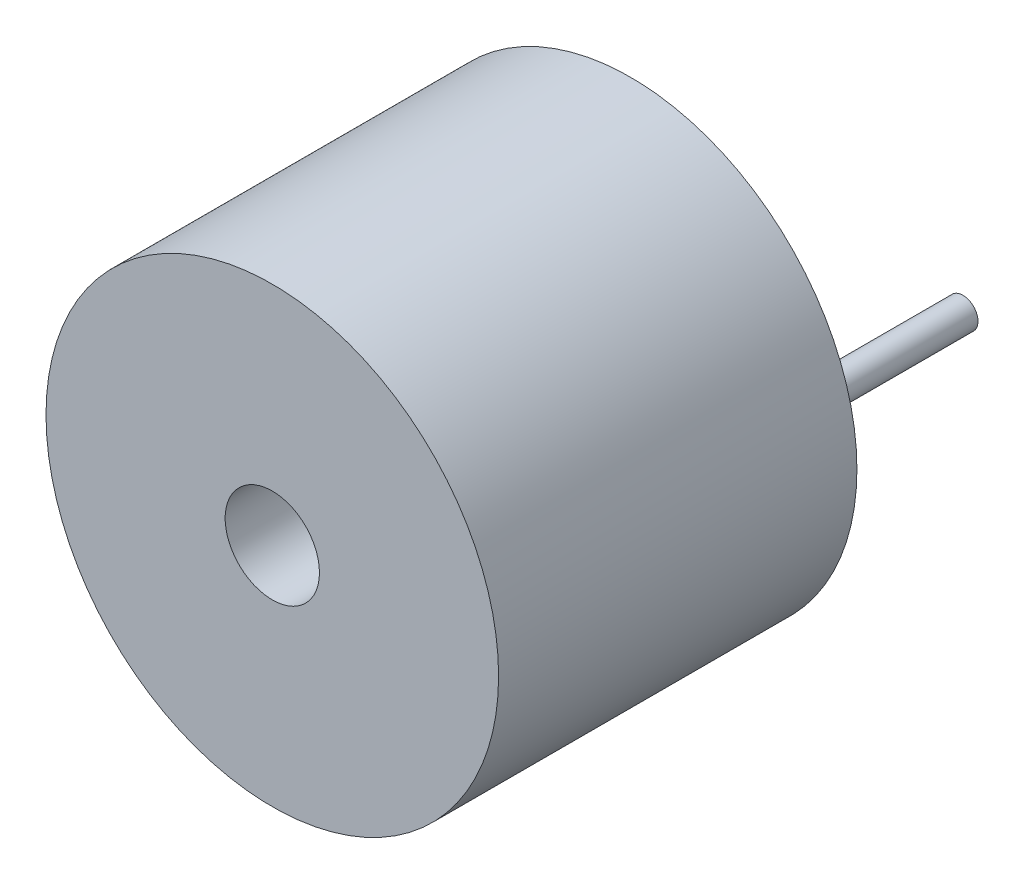
from build123d import *

# Parameters (mm, degrees)
SKETCH_1_R          = 6
EXTRUDE_1_DEPTH     = 9.5
SKETCH_2_R          = 0.4
EXTRUDE_2_DEPTH     = 5
SKETCH_3_R          = 1.25
CUT_EXTRUDE_1_DEPTH = 5


with BuildPart() as part:
    # 草图1 → 拉伸1 (new body)
    with BuildSketch(Plane.XY):
        Circle(SKETCH_1_R)
    extrude(amount=EXTRUDE_1_DEPTH)

    # 草图2 → 拉伸2 (add)
    with BuildSketch(Plane(origin=(0, 0, 0), x_dir=(-1, 0, 0), z_dir=(0, 0, -1))):
        with Locations((-3.81, 0)):
            Circle(SKETCH_2_R)
        with Locations((3.81, 0)):
            Circle(SKETCH_2_R)
    extrude(amount=EXTRUDE_2_DEPTH)

    # 草图3 → 切除-拉伸1 (cut)
    with BuildSketch(Plane.XY.offset(9.5)):
        Circle(SKETCH_3_R)
    extrude(amount=-CUT_EXTRUDE_1_DEPTH, mode=Mode.SUBTRACT)


solid = part.part
